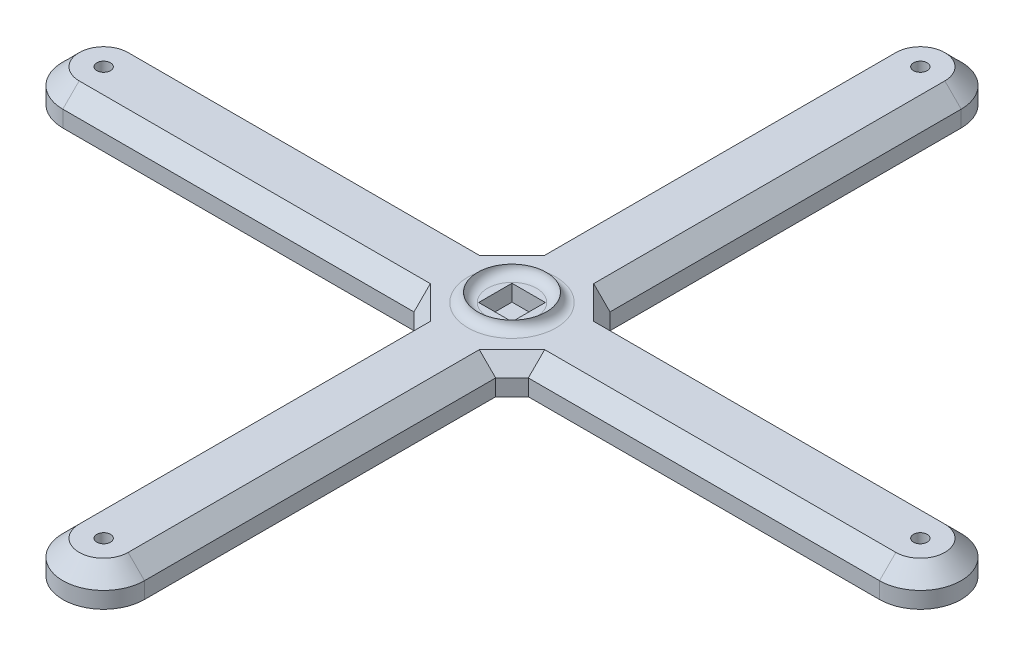
from build123d import *

# Parameters (mm, degrees)
BOSS_EXTRUDE1_DEPTH  = 20
CHAMFER1_SIZE        = 10
M8_CLEARANCE_HOLE1_D = 8.4
SKETCH13_W           = 20.4
SKETCH13_H           = 20.4
CUT_EXTRUDE1_DEPTH   = 10


# Read off the part's stored shape, not the designer's step: Revolve1
with BuildPart() as part:
    # Sketch1 → Boss-Extrude1 (new body)
    with BuildSketch(Plane(origin=(0, 0, 0), x_dir=(1, 0, 0), z_dir=(0, 1, 0))):
        with BuildLine():
            Line((25, 250), (25, -250))
            ThreePointArc((25, -250), (0, -275), (-25, -250))
            Line((-25, -250), (-25, 250))
            ThreePointArc((-25, 250), (0, 275), (25, 250))
        make_face()
        with BuildLine():
            Line((-250, 25), (250, 25))
            ThreePointArc((250, 25), (275, 0), (250, -25))
            Line((250, -25), (-250, -25))
            ThreePointArc((-250, -25), (-275, 0), (-250, 25))
        make_face()
    extrude(amount=BOSS_EXTRUDE1_DEPTH)

    # Chamfer1
    chamfer1_edges = [part.edges().sort_by_distance(p)[0] for p in [
        (275, 20, 0),
        (137.5, 20, 25),
        (137.5, 20, -25),
        (-137.5, 20, -25),
        (25, 10, -25),
        (-25, 10, -25),
        (25, 10, 25),
        (-25, 10, 25),
        (25, 20, -137.5),
        (25, 20, 137.5),
        (0, 20, 275),
        (-25, 20, -137.5),
        (-25, 20, 137.5),
        (0, 20, -275),
        (-275, 20, 0),
        (-137.5, 20, 25),
    ]]
    chamfer(chamfer1_edges, length=CHAMFER1_SIZE)

    # M8 Clearance Hole1 (through all)
    with Locations(Plane(origin=(0, 20, 0), x_dir=(1, 0, 0), z_dir=(0, 1, 0))):
        with Locations((-250, 0), (0, 250), (250, 0), (0, -250)):
            Hole(M8_CLEARANCE_HOLE1_D / 2)

    # Sketch13 → Cut-Extrude1 (cut)
    with BuildSketch(Plane(origin=(0, 20, 0), x_dir=(1, 0, 0), z_dir=(0, 1, 0))):
        Rectangle(SKETCH13_W, SKETCH13_H)
    extrude(amount=-CUT_EXTRUDE1_DEPTH, mode=Mode.SUBTRACT)

    # Revolve1 outline → Revolve1 (revolve)
    with BuildSketch(Plane.XY):
        with BuildLine():
            ThreePointArc((26.958266811, 20), (22.909428257, 21.591165693), (21, 25.5))
            ThreePointArc((21, 25.5), (19.090571743, 21.591165693), (15.041733189, 20))
            Line((15.041733189, 20), (26.958266811, 20))
        make_face()
    revolve(axis=Axis((0, 0, 0), (0, 1, 0)))


solid = part.part
